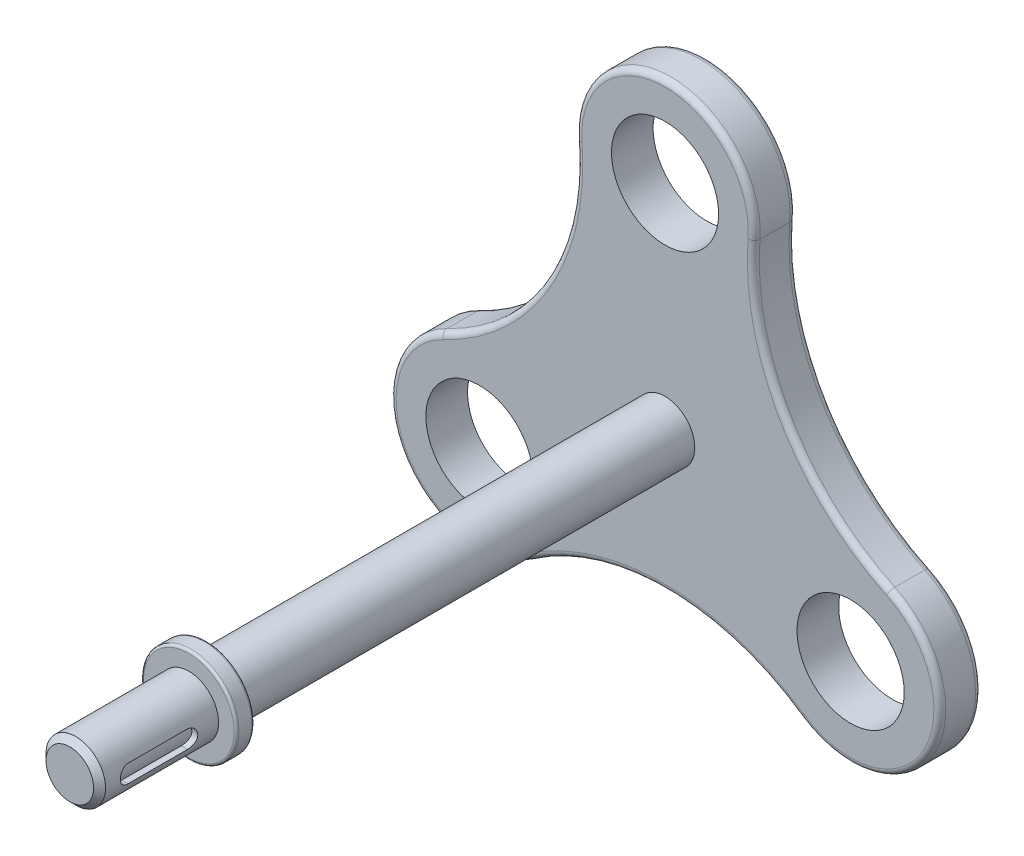
from build123d import *

# Parameters (mm, degrees)
SKETCH1_R            = 45
BOSS_EXTRUDE1_DEPTH  = 17.5
FILLET2_R            = 5
SKETCH5_R            = 25
BOSS_EXTRUDE2_DEPTH  = 500
BOSS_EXTRUDE5_START  = -115
SKETCH9_R            = 40
BOSS_EXTRUDE5_DEPTH  = 15
FILLET4_R            = 2
CUT_EXTRUDE1_START   = 20.000000098
CUT_EXTRUDE1_DEPTH   = 5.999999902
CUT_EXTRUDE1_START_2 = 18.540495647
CUT_EXTRUDE1_2_DEPTH = 1.459504451
CUT_EXTRUDE1_START_3 = 434
CUT_EXTRUDE1_3_DEPTH = 67
CHAMFER1_SIZE        = 5


with BuildPart() as part:
    # Sketch1 → Boss-Extrude1 (new, symmetric)
    with BuildSketch(Plane.XY):
        with BuildLine():
            ThreePointArc((74.765598524, 174.075029343), (0, 255), (-74.765598524, 174.075029343))
            ThreePointArc((-74.765598524, 174.075029343), (-100.935447166, 58.275107592), (-188.136196838, -22.28860702))
            ThreePointArc((-188.136196838, -22.28860702), (-220.836477965, -127.5), (-113.370598314, -151.786422323))
            ThreePointArc((-113.370598314, -151.786422323), (0, -116.550215184), (113.370598314, -151.786422323))
            ThreePointArc((113.370598314, -151.786422323), (220.836477965, -127.5), (188.136196838, -22.28860702))
            ThreePointArc((188.136196838, -22.28860702), (100.935447166, 58.275107592), (74.765598524, 174.075029343))
        make_face()
        with Locations((155.884572681, -90)):
            Circle(SKETCH1_R, mode=Mode.SUBTRACT)
        with Locations((0, 180)):
            Circle(SKETCH1_R, mode=Mode.SUBTRACT)
        with Locations((-155.884572681, -90)):
            Circle(SKETCH1_R, mode=Mode.SUBTRACT)
    extrude(amount=BOSS_EXTRUDE1_DEPTH, both=True)

    # Fillet2
    fillet2_edges = [part.edges().sort_by_distance(p)[0] for p in [
        (100.935447166, 58.275107592, 17.5),
        (0, 255, 17.5),
        (-100.935447166, 58.275107592, 17.5),
        (-220.836477965, -127.5, 17.5),
        (0, -116.550215184, 17.5),
        (-220.836477965, -127.5, -17.5),
        (-100.935447166, 58.275107592, -17.5),
        (0, 255, -17.5),
        (100.935447166, 58.275107592, -17.5),
        (220.836477965, -127.5, -17.5),
        (0, -116.550215184, -17.5),
        (220.836477965, -127.5, 17.5),
    ]]
    fillet(fillet2_edges, radius=FILLET2_R)

    # Sketch5 → Boss-Extrude2 (add)
    with BuildSketch(Plane.XY.offset(17.5)):
        Circle(SKETCH5_R)
    extrude(amount=BOSS_EXTRUDE2_DEPTH)

    # Sketch9 → Boss-Extrude5 (add)
    with BuildSketch(Plane.XY.offset(517.5).offset(BOSS_EXTRUDE5_START)):
        Circle(SKETCH9_R)
    extrude(amount=BOSS_EXTRUDE5_DEPTH)

    # Fillet4
    fillet4_edges = [part.edges().sort_by_distance(p)[0] for p in [
        (-40, 0, 402.5),
        (-40, 0, 417.5),
    ]]
    fillet(fillet4_edges, radius=FILLET4_R)

    # Cut-Extrude1: read off the stored shape, not the designer's step
    # Cut-Extrude1 outline → Cut-Extrude1 (cut)
    with BuildSketch(Plane(origin=(0, 0, 0), x_dir=(0, 0, -1), z_dir=(1, 0, 0)).offset(CUT_EXTRUDE1_START)):
        with BuildLine():
            ThreePointArc((-492.5, 7.5), (-500, 0), (-492.5, -7.5))
            Line((-492.5, -7.5), (-442.5, -7.5))
            ThreePointArc((-442.5, -7.5), (-435, 0), (-442.5, 7.5))
            Line((-442.5, 7.5), (-492.5, 7.5))
        make_face()
    extrude(amount=CUT_EXTRUDE1_DEPTH, mode=Mode.SUBTRACT)

    # Cut-Extrude1 2 outline → Cut-Extrude1 2 (cut)
    with BuildSketch(Plane.YZ.offset(CUT_EXTRUDE1_START_2)):
        with BuildLine():
            ThreePointArc((7.5, 492.5), (0, 500), (-7.5, 492.5))
            Line((-7.5, 492.5), (-7.5, 442.5))
            ThreePointArc((-7.5, 442.5), (0, 435), (7.5, 442.5))
            Line((7.5, 442.5), (7.5, 492.5))
        make_face()
    extrude(amount=CUT_EXTRUDE1_2_DEPTH, mode=Mode.SUBTRACT)

    # Cut-Extrude1 3 outline → Cut-Extrude1 3 (add)
    with BuildSketch(Plane.XY.offset(CUT_EXTRUDE1_START_3)):
        with BuildLine():
            ThreePointArc((18.54049136, -7.50001201), (20, 0), (18.54049136, 7.50001201))
            Line((18.54049136, 7.50001201), (18.54049136, -7.50001201))
        make_face()
    extrude(amount=CUT_EXTRUDE1_3_DEPTH)

    # Chamfer1
    chamfer1_edges = [part.edges().sort_by_distance(p)[0] for p in [
        (-25, 0, 517.5),
    ]]
    chamfer(chamfer1_edges, length=CHAMFER1_SIZE)


solid = part.part
